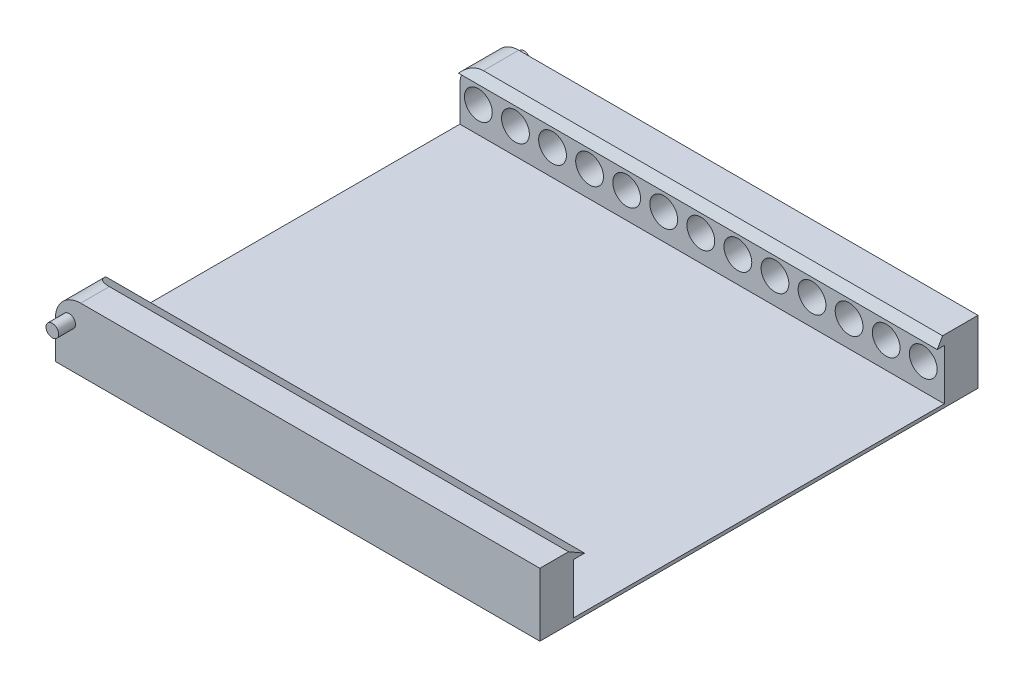
from build123d import *

# Parameters (mm, degrees)
BOSS_EXTRUDE1_DEPTH     = 575
CHAMFER1_SIZE           = 10.969655115
CHAMFER1_SIZE_2         = 19
FILLET1_R               = 30
CUT_EXTRUDE1_DEPTH      = 250
CUT_EXTRUDE1_DEPTH_BACK = 250
SKETCH3_R               = 16.5
SKETCH4_R               = 7.5
BOSS_EXTRUDE2_DEPTH     = 20
BOSS_EXTRUDE3_START     = 20
SKETCH5_R               = 7.5
BOSS_EXTRUDE3_DEPTH     = 20


with BuildPart() as part:
    # Sketch2 → Boss-Extrude1 (new body)
    with BuildSketch(Plane(origin=(0, 0, 0), x_dir=(0, 0, -1), z_dir=(1, 0, 0))):
        Polygon((-260, 0), (260, 0), (260, 75), (207, 75), (207, 64), (220, 64), (220, 4), (-220, 4), (-220, 64), (-207, 64), (-207, 75), (-260, 75), align=None)
    extrude(amount=-BOSS_EXTRUDE1_DEPTH)

    # Chamfer1
    # the kernel refuses this chamfer: 19, 10.969655115 mm, written as the material it takes off along each edge
    with BuildSketch(Plane(origin=(49.154629338, 75, -207), x_dir=(0, 0.057893862402671324, -0.9983227437537925), z_dir=(-1, 0, 0)), Plane(origin=(49.154629338, 75, 207), x_dir=(0, -0.9983227437537926, -0.057893862402671296), z_dir=(-1, 0, 0))) as chamfer1_piece_1:
        Polygon((CHAMFER1_SIZE * 0.998322743718, CHAMFER1_SIZE * 0.0578938624006), (-CHAMFER1_SIZE_2 * 0.0578938624027, CHAMFER1_SIZE_2 * 0.998322743754), (0, 0), align=None)
    extrude(amount=673.309258677, mode=Mode.SUBTRACT)

    # Fillet1
    fillet1_edges = [part.edges().sort_by_distance(p)[0] for p in [
        (-575, 75, 243),
        (-575, 75, -238.984827557),
    ]]
    fillet(fillet1_edges, radius=FILLET1_R)

    # Sketch3 → Cut-Extrude1 (cut, two sides: drawn at the far end of the back side and taken through both)
    with BuildSketch(Plane.XY.offset(-CUT_EXTRUDE1_DEPTH_BACK)):
        with Locations((-25, 35)):
            Circle(SKETCH3_R)
        with Locations((-69, 35)):
            Circle(SKETCH3_R)
        with Locations((-113, 35)):
            Circle(SKETCH3_R)
        with Locations((-157, 35)):
            Circle(SKETCH3_R)
        with Locations((-201, 35)):
            Circle(SKETCH3_R)
        with Locations((-245, 35)):
            Circle(SKETCH3_R)
        with Locations((-289, 35)):
            Circle(SKETCH3_R)
        with Locations((-333, 35)):
            Circle(SKETCH3_R)
        with Locations((-377, 35)):
            Circle(SKETCH3_R)
        with Locations((-421, 35)):
            Circle(SKETCH3_R)
        with Locations((-465, 35)):
            Circle(SKETCH3_R)
        with Locations((-509, 35)):
            Circle(SKETCH3_R)
        with Locations((-553, 35)):
            Circle(SKETCH3_R)
    extrude(amount=CUT_EXTRUDE1_DEPTH + CUT_EXTRUDE1_DEPTH_BACK, mode=Mode.SUBTRACT)

    # Sketch4 → Boss-Extrude2 (add)
    with BuildSketch(Plane.XY.offset(260)):
        with Locations((-558.68, 50)):
            Circle(SKETCH4_R)
    extrude(amount=BOSS_EXTRUDE2_DEPTH)

    # Sketch5 → Boss-Extrude3 (add)
    with BuildSketch(Plane(origin=(0, 0, -260), x_dir=(-1, 0, 0), z_dir=(0, 0, -1)).offset(BOSS_EXTRUDE3_START)):
        with Locations(Location((558.68, 50, 0), (0, 0, 180))):
            Circle(SKETCH5_R)
    extrude(amount=-BOSS_EXTRUDE3_DEPTH)


solid = part.part
